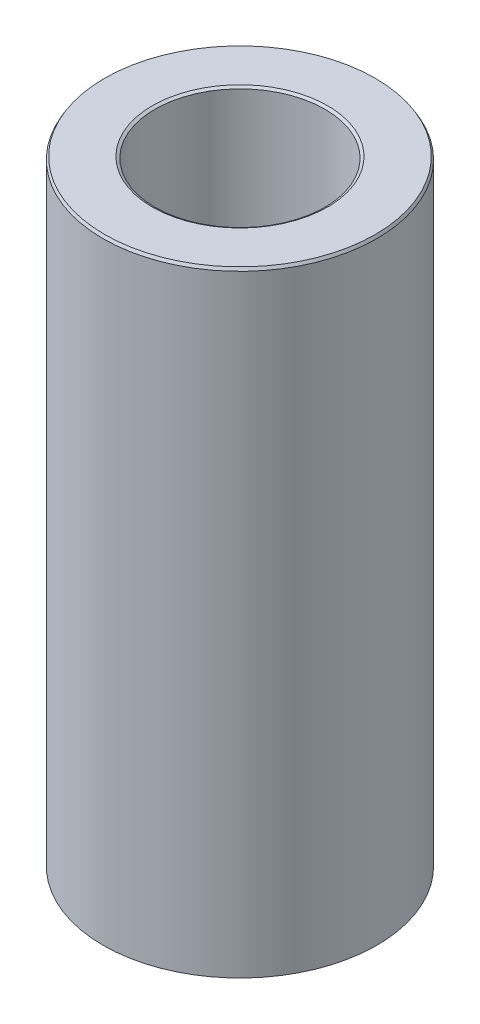
from build123d import *
from OCP.BRepFilletAPI import BRepFilletAPI_MakeChamfer

# Parameters (mm, degrees)
SKETCH1_R           = 60
BOSS_EXTRUDE1_DEPTH = 270.104100479
SKETCH2_R           = 37.231580559
CUT_EXTRUDE1_DEPTH  = 284.118747341
CHAMFER1_SIZE       = 1.215002225
CHAMFER1_SIZE2      = 0.701481862


with BuildPart() as part:
    # Sketch1 → Boss-Extrude1 (new body)
    with BuildSketch(Plane(origin=(0, 0, 0), x_dir=(1, 0, 0), z_dir=(0, 1, 0))):
        Circle(SKETCH1_R)
    extrude(amount=BOSS_EXTRUDE1_DEPTH)

    # Sketch2 → Cut-Extrude1 (cut, through all)
    with BuildSketch(Plane(origin=(0, 0, 0), x_dir=(1, 0, 0), z_dir=(0, 1, 0))):
        Circle(SKETCH2_R)
    extrude(amount=CUT_EXTRUDE1_DEPTH, mode=Mode.SUBTRACT)

    # Chamfer1: one chamfer whose edges measure the first distance from different faces: ONE call of the kernel's chamfer builder (chamfer() names one face for all edges)
    chamfer1_edges_1 = [part.edges().sort_by_distance(p)[0] for p in [
        (-37.231580559, 270.104100479, 0),
    ]]
    chamfer1_side_1 = [part.faces().sort_by_distance(p)[0] for p in [
        (-58.302943725, 270.104100479, 0),
    ]]
    chamfer1_edges_2 = [part.edges().sort_by_distance(p)[0] for p in [
        (-37.231580559, 0, 0),
    ]]
    chamfer1_side_2 = [part.faces().sort_by_distance(p)[0] for p in [
        (-37.231580559, 135.05205024, 0),
    ]]
    chamfer1_edges_3 = [part.edges().sort_by_distance(p)[0] for p in [
        (-60, 0, 0),
    ]]
    chamfer1_side_3 = [part.faces().sort_by_distance(p)[0] for p in [
        (-58.302943725, 0, 0),
    ]]
    chamfer1_edges_4 = [part.edges().sort_by_distance(p)[0] for p in [
        (-60, 270.104100479, 0),
    ]]
    chamfer1_side_4 = [part.faces().sort_by_distance(p)[0] for p in [
        (-60, 135.05205024, 0),
    ]]
    chamfer1 = BRepFilletAPI_MakeChamfer(part.part.solid().wrapped)
    for e in chamfer1_edges_1:
        chamfer1.Add(CHAMFER1_SIZE, CHAMFER1_SIZE2, e.wrapped, chamfer1_side_1[0].wrapped)  # the first distance lies on this face
    for e in chamfer1_edges_2:
        chamfer1.Add(CHAMFER1_SIZE, CHAMFER1_SIZE2, e.wrapped, chamfer1_side_2[0].wrapped)  # the first distance lies on this face
    for e in chamfer1_edges_3:
        chamfer1.Add(CHAMFER1_SIZE, CHAMFER1_SIZE2, e.wrapped, chamfer1_side_3[0].wrapped)  # the first distance lies on this face
    for e in chamfer1_edges_4:
        chamfer1.Add(CHAMFER1_SIZE, CHAMFER1_SIZE2, e.wrapped, chamfer1_side_4[0].wrapped)  # the first distance lies on this face
    add(Compound.cast(chamfer1.Shape()), mode=Mode.REPLACE)


solid = part.part
